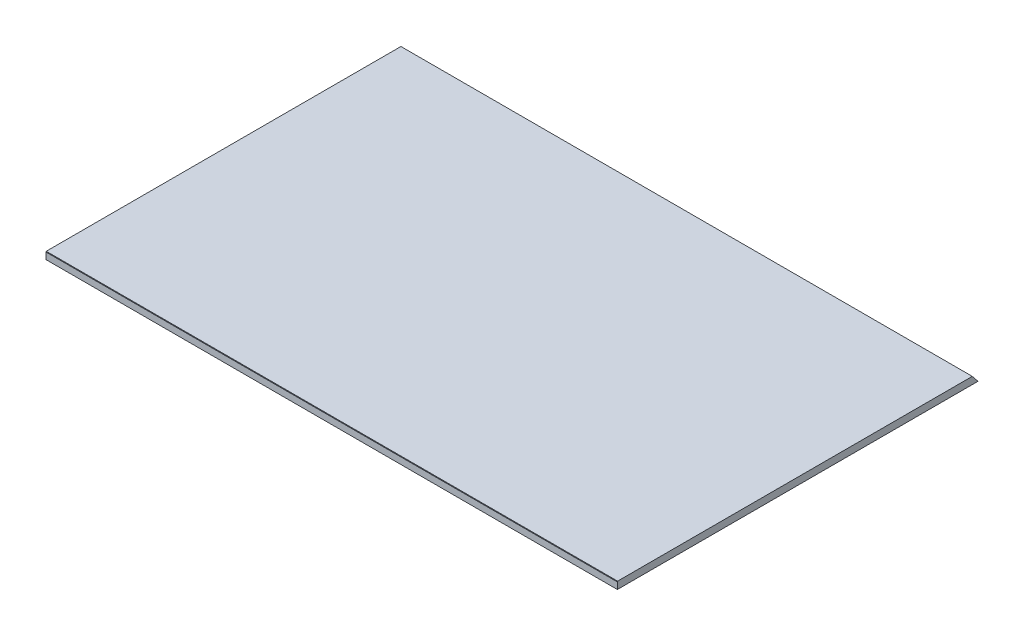
from build123d import *

# Parameters (mm, degrees)
BOSS_EXTRUDE2_DEPTH      = 160
CUT_EXTRUDE11_DEPTH      = 201.089979759
CUT_EXTRUDE11_DEPTH_BACK = 201.089979759
SKETCH12_W               = 233
SKETCH12_H               = 21
CUT_EXTRUDE12_DEPTH      = 2
SKETCH13_W               = 7
SKETCH13_H               = 23
BOSS_EXTRUDE3_DEPTH      = 2
CUT_EXTRUDE13_DEPTH      = 324.208910768
CUT_EXTRUDE13_DEPTH_BACK = 324.208910768


with BuildPart() as part:
    # Sketch8 → Boss-Extrude2 (new, symmetric)
    with BuildSketch(Plane(origin=(0, 0, 0), x_dir=(0, 0, -1), z_dir=(1, 0, 0))):
        Polygon((-88.104080333, -6), (62.895919667, -6), (80.895919667, -3.176729887), (80.976403784, -2.998472611), (82.781317846, 0.999074726), (78.781317846, 5.999074726), (-119.85604145, 6), (-120, 5.68), (-120, 1.998947428), (-106.104080333, -6), align=None)
    extrude(amount=BOSS_EXTRUDE2_DEPTH, both=True)

    # Sketch9 → Cut-Extrude11 (cut, two sides: drawn at the far end of the back side and taken through both)
    with BuildSketch(Plane.XY.offset(-CUT_EXTRUDE11_DEPTH_BACK)):
        Polygon((-160, -6), (-142, -6), (-160, 1.998947428), align=None)
        Polygon((160, -6), (142, -6), (160, 1.998947428), align=None)
    extrude(amount=CUT_EXTRUDE11_DEPTH + CUT_EXTRUDE11_DEPTH_BACK, mode=Mode.SUBTRACT)

    # Sketch12 → Cut-Extrude12 (cut)
    with BuildSketch(Plane.XZ.offset(6)):
        with Locations((1.5, -28.395919667)):
            Rectangle(SKETCH12_W, SKETCH12_H)
    extrude(amount=-CUT_EXTRUDE12_DEPTH, mode=Mode.SUBTRACT)

    # Sketch13 → Boss-Extrude3 (add)
    with BuildSketch(Plane.XZ.offset(6)):
        with Locations((-136.5, 92.604080333)):
            Rectangle(SKETCH13_W, SKETCH13_H)
        with Locations((-136.5, -49.395919667)):
            Rectangle(SKETCH13_W, SKETCH13_H)
        with Locations((136.5, -49.395919667)):
            Rectangle(SKETCH13_W, SKETCH13_H)
        with Locations((136.5, 92.604080333)):
            Rectangle(SKETCH13_W, SKETCH13_H)
    extrude(amount=BOSS_EXTRUDE3_DEPTH)

    # Sketch14 → Cut-Extrude13 (cut, two sides: drawn at the far end of the back side and taken through both)
    with BuildSketch(Plane.ZY.offset(140).offset(-CUT_EXTRUDE13_DEPTH_BACK)):
        Polygon((-60.895919667, -8), (-54.223413834, -8), (-60.895919667, -6), align=None)
        Polygon((-37.895919667, -6), (-45.223413834, -8), (-37.895919667, -8), align=None)
        Polygon((104.104080333, -6), (96.367273939, -8), (104.104080333, -8), align=None)
        Polygon((81.104080333, -8), (87.367273939, -8), (81.104080333, -6), align=None)
    extrude(amount=CUT_EXTRUDE13_DEPTH + CUT_EXTRUDE13_DEPTH_BACK, mode=Mode.SUBTRACT)


solid = part.part
